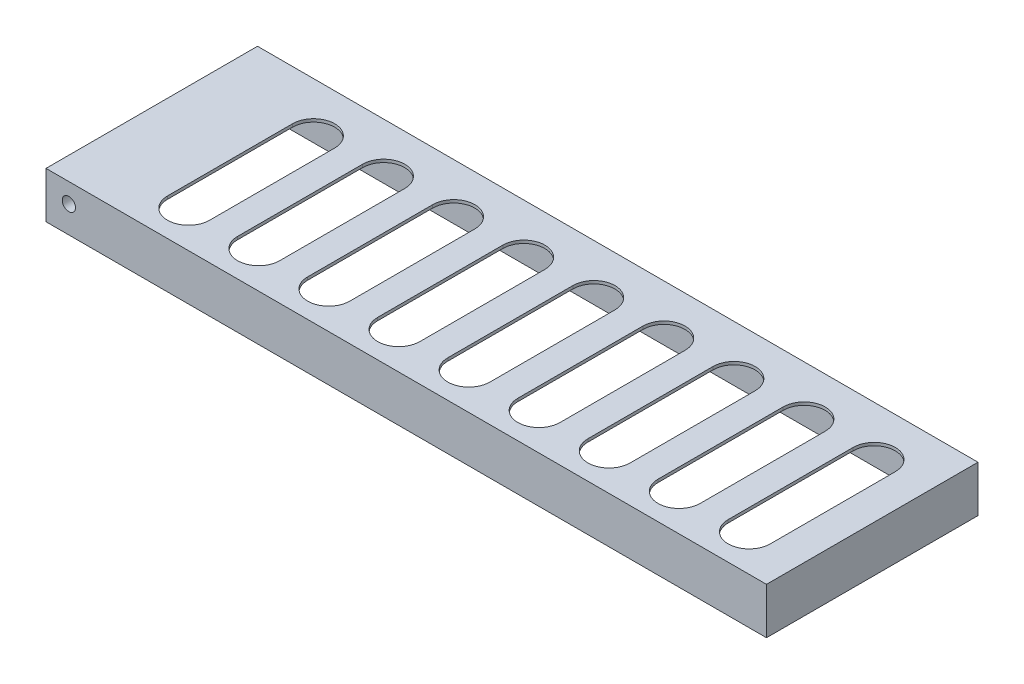
from build123d import *

# Parameters (mm, degrees)
SKETCH1_W           = 2768.6
SKETCH1_H           = 812.8
BOSS_EXTRUDE1_DEPTH = 177.8
SKETCH2_R           = 25.4
CUT_EXTRUDE1_DEPTH  = 831.342
SKETCH3_W           = 2644.359498688
SKETCH3_H           = 740.774814922
CUT_EXTRUDE2_DEPTH  = 166.37
CUT_EXTRUDE3_DEPTH  = 57.912
FILL_START          = 166.37
FILL_PATTERN1_DEPTH = 11.43
SCALE1_SCALE        = 0.5867


# Read off the part's stored shape, not the designer's step: Fill Pattern1
with BuildPart() as part:
    # Sketch1 → Boss-Extrude1 (new body)
    with BuildSketch(Plane(origin=(0, 0, 0), x_dir=(1, 0, 0), z_dir=(0, 1, 0))):
        Rectangle(SKETCH1_W, SKETCH1_H)
    extrude(amount=BOSS_EXTRUDE1_DEPTH)

    # Sketch2 → Cut-Extrude1 (cut)
    with BuildSketch(Plane.XY.offset(406.4)):
        with Locations((-1296.438284971, 103.124)):
            Circle(SKETCH2_R)
    extrude(amount=-CUT_EXTRUDE1_DEPTH, mode=Mode.SUBTRACT)

    # Sketch3 → Cut-Extrude2 (cut)
    with BuildSketch(Plane.XZ):
        Rectangle(SKETCH3_W, SKETCH3_H)
    extrude(amount=-CUT_EXTRUDE2_DEPTH, mode=Mode.SUBTRACT)

    # Sketch12 → Cut-Extrude3 (cut)
    with BuildSketch(Plane.XZ.offset(-166.37)):
        with BuildLine():
            Line((-897.344557037, 264.630737371), (-897.344557037, -215.907837093))
            ThreePointArc((-897.344557037, -215.907837093), (-978.253251545, -296.816531601), (-1059.161946053, -215.907837093))
            Line((-1059.161946053, -215.907837093), (-1059.161946053, 264.630737371))
            ThreePointArc((-1059.161946053, 264.630737371), (-978.253251545, 345.539431879), (-897.344557037, 264.630737371))
        make_face()
    extrude(amount=-CUT_EXTRUDE3_DEPTH, mode=Mode.SUBTRACT)

    # Fill Pattern1 outline → Fill Pattern1 (cut)
    with BuildSketch(Plane(origin=(0, 0, 0), x_dir=(1, 0, 0), z_dir=(0, 1, 0)).offset(FILL_START)):
        with BuildLine():
            ThreePointArc((-789.87554691, -264.630737371), (-708.966852402, -345.539431879), (-628.058157894, -264.630737371))
            Line((-628.058157894, -264.630737371), (-628.058157894, 215.907837093))
            ThreePointArc((-628.058157894, 215.907837093), (-708.966852402, 296.816531601), (-789.87554691, 215.907837093))
            Line((-789.87554691, 215.907837093), (-789.87554691, -264.630737371))
        make_face()
        with BuildLine():
            ThreePointArc((1095.129247093, -264.630737371), (1176.0379416, -345.539431879), (1256.946636108, -264.630737371))
            Line((1256.946636108, -264.630737371), (1256.946636108, 215.907837093))
            ThreePointArc((1256.946636108, 215.907837093), (1176.0379416, 296.816531601), (1095.129247093, 215.907837093))
            Line((1095.129247093, 215.907837093), (1095.129247093, -264.630737371))
        make_face()
        with BuildLine():
            ThreePointArc((825.842847949, -264.630737371), (906.751542457, -345.539431879), (987.660236965, -264.630737371))
            Line((987.660236965, -264.630737371), (987.660236965, 215.907837093))
            ThreePointArc((987.660236965, 215.907837093), (906.751542457, 296.816531601), (825.842847949, 215.907837093))
            Line((825.842847949, 215.907837093), (825.842847949, -264.630737371))
        make_face()
        with BuildLine():
            ThreePointArc((556.556448806, -264.630737371), (637.465143314, -345.539431879), (718.373837822, -264.630737371))
            Line((718.373837822, -264.630737371), (718.373837822, 215.907837093))
            ThreePointArc((718.373837822, 215.907837093), (637.465143314, 296.816531601), (556.556448806, 215.907837093))
            Line((556.556448806, 215.907837093), (556.556448806, -264.630737371))
        make_face()
        with BuildLine():
            ThreePointArc((287.270049663, -264.630737371), (368.178744171, -345.539431879), (449.087438678, -264.630737371))
            Line((449.087438678, -264.630737371), (449.087438678, 215.907837093))
            ThreePointArc((449.087438678, 215.907837093), (368.178744171, 296.816531601), (287.270049663, 215.907837093))
            Line((287.270049663, 215.907837093), (287.270049663, -264.630737371))
        make_face()
        with BuildLine():
            ThreePointArc((17.98365052, -264.630737371), (98.892345027, -345.539431879), (179.801039535, -264.630737371))
            Line((179.801039535, -264.630737371), (179.801039535, 215.907837093))
            ThreePointArc((179.801039535, 215.907837093), (98.892345027, 296.816531601), (17.98365052, 215.907837093))
            Line((17.98365052, 215.907837093), (17.98365052, -264.630737371))
        make_face()
        with BuildLine():
            ThreePointArc((-251.302748623, -264.630737371), (-170.394054116, -345.539431879), (-89.485359608, -264.630737371))
            Line((-89.485359608, -264.630737371), (-89.485359608, 215.907837093))
            ThreePointArc((-89.485359608, 215.907837093), (-170.394054116, 296.816531601), (-251.302748623, 215.907837093))
            Line((-251.302748623, 215.907837093), (-251.302748623, -264.630737371))
        make_face()
        with BuildLine():
            ThreePointArc((-520.589147766, -264.630737371), (-439.680453258, -345.539431879), (-358.771758751, -264.630737371))
            Line((-358.771758751, -264.630737371), (-358.771758751, 215.907837093))
            ThreePointArc((-358.771758751, 215.907837093), (-439.680453258, 296.816531601), (-520.589147766, 215.907837093))
            Line((-520.589147766, 215.907837093), (-520.589147766, -264.630737371))
        make_face()
    extrude(amount=FILL_PATTERN1_DEPTH, mode=Mode.SUBTRACT)


with BuildPart() as part_1:
    # Scale1: scaled about (-12.682340198, 104.835478071, -3.853275395)
    add(part.part.scale(SCALE1_SCALE).moved(Location((-5.241611204, 43.328503087, -1.592558721))))


solid = part_1.part
